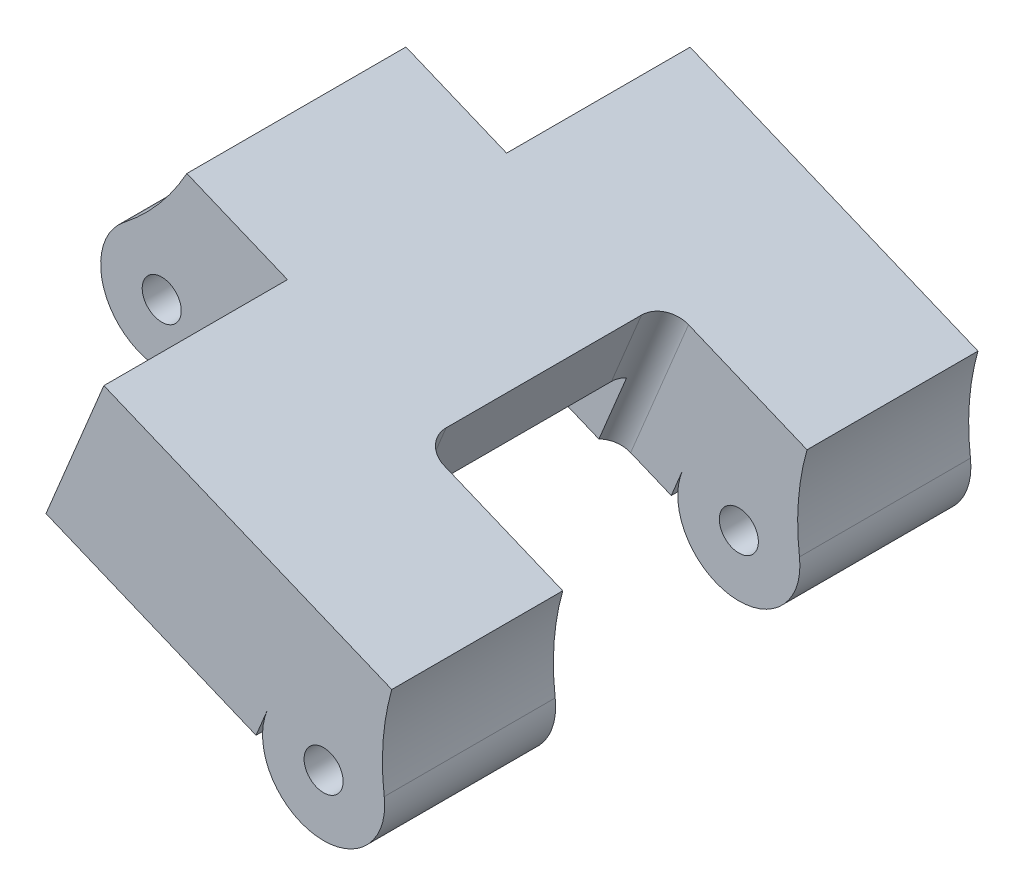
from build123d import *
from OCP.BRepAlgoAPI import BRepAlgoAPI_Cut
from OCP.TopTools import TopTools_ListOfShape

# Parameters (mm, degrees)
SALIENTE_EXTRUIR1_DEPTH      = 8
SALIENTE_EXTRUIR1_DEPTH_BACK = 16
CROQUIS1_R                   = 0.8000000000000019
CROQUIS1_R_2                 = 0.8000000000000002
CROQUIS3_W                   = 5.999999999999999
CROQUIS3_H                   = 7.5149398575439825
CORTAR_EXTRUIR1_DEPTH        = 16
CROQUIS4_W                   = 12.500000000000004
CROQUIS4_H                   = 10.000000000000002
CORTAR_EXTRUIR2_DEPTH        = 16
REDONDEO1_R                  = 10
CORTAR_EXTRUIR3_DEPTH        = 39.561831595033986
SALIENTE_EXTRUIR2_START      = -7
SALIENTE_EXTRUIR2_DEPTH      = 7
SALIENTE_EXTRUIR3_START      = -7
SALIENTE_EXTRUIR3_DEPTH      = 7
CORTAR_EXTRUIR4_DEPTH        = 39.561831595033986
SALIENTE_EXTRUIR4_START      = 0.5
SALIENTE_EXTRUIR4_DEPTH      = 0.5
SALIENTE_EXTRUIR5_DEPTH      = 0.5
REDONDEO2_R                  = 1
SALIENTE_EXTRUIR6_DEPTH      = 7.5
SALIENTE_EXTRUIR7_DEPTH      = 7.5
CORTAR_EXTRUIR5_DEPTH        = 6.192871


with BuildPart() as part:
    # Croquis1 → Saliente-Extruir1 (new, two sides: drawn at the far end of the back side and taken through both)
    with BuildSketch(Plane.XY.offset(-SALIENTE_EXTRUIR1_DEPTH_BACK)):
        with BuildLine():
            Line((2.309746663820058, 19.04340690522453), (11.832681853129706, 15.099435825287522))
            ThreePointArc((11.832681853129735, 15.099435825287586), (14.633813116183077, 11.69161014757831), (15.904999780297969, 15.915790146996653))
            Line((15.904999780297969, 15.915790146996654), (16.93335681353175, 18.398814789031395))
            Line((16.93335681353175, 18.398814789031395), (1.029391105834504, 24.985521467228967))
            Line((1.029391105834504, 24.985521467228967), (0, 22.5))
            ThreePointArc((-2.2e-16, 22.5), (-2.078639306967261, 18.611022451034337), (2.3097466638200577, 19.04340690522453))
        make_face()
        with Locations((14.142428516949789, 14.142842730512115)):
            Circle(CROQUIS1_R, mode=Mode.SUBTRACT)
        with Locations((-8e-16, 20)):
            Circle(CROQUIS1_R_2, mode=Mode.SUBTRACT)
    extrude(amount=SALIENTE_EXTRUIR1_DEPTH + SALIENTE_EXTRUIR1_DEPTH_BACK)

    # Croquis3 → Cortar-Extruir1 (cut)
    with BuildSketch(Plane(origin=(8.98354685928157, 21.691268210929703, 0), x_dir=(0.9238986655280315, -0.38263723791016835, 0), z_dir=(0.38263723791016835, 0.9238986655280315, 0))):
        Polygon((-10.15274475820337, -8), (-4.152744758203371, -8), (-4.152744758203371, -0.4850601424560169), (-10.15274475820337, -0.48506014245601775), align=None)
        with Locations((-7.1527447582033705, 12.242530071228009)):
            Rectangle(CROQUIS3_W, CROQUIS3_H)
    extrude(amount=-CORTAR_EXTRUIR1_DEPTH, mode=Mode.SUBTRACT)

    # Croquis4 → Cortar-Extruir2 (cut)
    with BuildSketch(Plane(origin=(8.98354685928157, 21.691268210929703, 0), x_dir=(0.9238986655280315, -0.38263723791016835, 0), z_dir=(0.38263723791016835, 0.9238986655280315, 0))):
        with Locations((8.604634091236255, 4.000000000000001)):
            Rectangle(CROQUIS4_W, CROQUIS4_H)
    extrude(amount=-CORTAR_EXTRUIR2_DEPTH, mode=Mode.SUBTRACT)

    # Redondeo1
    # the kernel refuses this fillet: 10 mm, written as the material it adds along each edge
    with BuildSketch(Plane(origin=(15.90499978029797, 15.915790146996653, 1), x_dir=(0.43937810664982085, -0.898302220523148, 0), z_dir=(0, 0, 1))) as redondeo1_piece_1:
        with BuildLine():
            CenterArc((4.909244259441116, 9.449263834962537), REDONDEO1_R, 228.0261529616087, 22.86990266701423)
            Line((-1.7786689833312208, 2.0147620724265707), (-1.9124272481866686, 1.8660720371758521))
            ThreePointArc((-1.9124272481866686, 1.8660720371758521), (-1.0392674370387214, 0.8750174766821813), (-0.14993294537311094, -0.13236355953110399))
            Line((-0.14993294537311094, -0.13236355953110399), (0.06545659012588191, -0.18898527669924975))
            ThreePointArc((0.06545659012588191, -0.18898527669924975), (0.8182073765735266, -0.06231595874062915), (1.5709581630211649, -0.18898527669925216))
            Line((1.5709581630211649, -0.18898527669925216), (1.636414753147047, 6e-17))
        make_face()
    extrude(amount=7)
    with BuildSketch(Plane(origin=(15.90499978029797, 15.915790146996653, -16), x_dir=(0.43937810664982085, -0.898302220523148, 0), z_dir=(0, 0, 1))) as redondeo1_piece_2:
        with BuildLine():
            CenterArc((4.909244259441116, 9.449263834962537), REDONDEO1_R, 228.0261529616087, 22.86990266701423)
            Line((-1.7786689833312208, 2.0147620724265707), (-1.9124272481866686, 1.8660720371758521))
            ThreePointArc((-1.9124272481866686, 1.8660720371758521), (-1.0392674370387214, 0.8750174766821813), (-0.14993294537311094, -0.13236355953110399))
            Line((-0.14993294537311094, -0.13236355953110399), (0.06545659012588191, -0.18898527669924975))
            ThreePointArc((0.06545659012588191, -0.18898527669924975), (0.8182073765735266, -0.06231595874062915), (1.5709581630211649, -0.18898527669925216))
            Line((1.5709581630211649, -0.18898527669925216), (1.636414753147047, 6e-17))
        make_face()
    extrude(amount=6.999999999999998)
    with BuildSketch(Plane(origin=(-1.1e-16, 22.5, 0.4850601424560175), x_dir=(-0.9451707970750715, -0.3265764295788571, 0), z_dir=(0, 0, -1))) as redondeo1_piece_3:
        with BuildLine():
            CenterArc((4.898646443682852, 9.451707970750716), REDONDEO1_R, 228.06162230808002, 22.877267808488114)
            Line((-1.784663138412825, 2.0130674343443404), (-1.9183293300547388, 1.8642946236162135))
            ThreePointArc((-1.9183293300547388, 1.8642946236162135), (-1.0419879162330352, 0.8738575030467765), (-0.149656347026621, -0.13267621412539496))
            Line((-0.149656347026621, -0.13267621412539496), (0.06531528591577111, -0.18903415941501364))
            ThreePointArc((0.06531528591577111, -0.18903415941501364), (0.8164410739471419, -0.06292699268767933), (1.5675668619785121, -0.1890341594150131))
            Line((1.5675668619785121, -0.1890341594150131), (1.6328821478942839, -5e-17))
        make_face()
    extrude(amount=8.970120284912035)

    # Croquis5 → Cortar-Extruir3 (cut, through all)
    with BuildSketch(Plane.XY.offset(8)):
        with BuildLine():
            Line((2.309746663820078, 19.04340690522458), (2.8048354948987004, 20.238826130100847))
            ThreePointArc((2.8048354948987004, 20.238826130100847), (7.811221113299703, 18.852662916127482), (12.314929423667346, 16.26384911999791))
            Line((12.314929423667346, 16.26384911999791), (11.83268185312971, 15.099435825287534))
            Line((11.83268185312971, 15.099435825287534), (2.309746663820078, 19.04340690522458))
        make_face()
    extrude(amount=-CORTAR_EXTRUIR3_DEPTH, mode=Mode.SUBTRACT)

    # Croquis7 → Saliente-Extruir2 (add)
    with BuildSketch(Plane(origin=(0, 0, -16), x_dir=(-1, 0, 0), z_dir=(0, 0, -1)).offset(SALIENTE_EXTRUIR2_START)):
        with BuildLine():
            Line((-12.314929423667346, 16.26384911999791), (-11.83268185312971, 15.099435825287534))
            Line((-11.83268185312971, 15.099435825287534), (-2.309746663820078, 19.04340690522458))
            Line((-2.309746663820078, 19.04340690522458), (-2.8048354948986987, 20.238826130100847))
            ThreePointArc((-2.8048354948986987, 20.238826130100847), (-7.811221113299688, 18.852662916127446), (-12.314929423667346, 16.26384911999791))
        make_face()
    extrude(amount=SALIENTE_EXTRUIR2_DEPTH)

    # Croquis8 → Saliente-Extruir3 (add)
    with BuildSketch(Plane.XY.offset(8).offset(SALIENTE_EXTRUIR3_START)):
        with BuildLine():
            Line((11.83268185312971, 15.099435825287534), (12.314929423667346, 16.26384911999791))
            ThreePointArc((12.314929423667346, 16.26384911999791), (11.149114957675053, 17.083977118308297), (9.929630744917306, 17.821941587347368))
            ThreePointArc((9.929630744917306, 17.821941587347368), (6.961487524857346, 19.186020427437004), (3.815730334224168, 20.066245940784494))
            ThreePointArc((3.815730334224168, 20.066245940784494), (3.311351692275589, 20.158796440416758), (2.8048354948986964, 20.238826130100843))
            Line((2.8048354948986964, 20.238826130100843), (2.309746663820078, 19.04340690522458))
            Line((2.309746663820078, 19.04340690522458), (11.83268185312971, 15.099435825287534))
        make_face()
    extrude(amount=SALIENTE_EXTRUIR3_DEPTH)

    # Croquis9 → Cortar-Extruir4 (cut, through all)
    with BuildSketch(Plane(origin=(0, 0, -16), x_dir=(-1, 0, 0), z_dir=(0, 0, -1))):
        Polygon((-3.815730334224168, 20.066245940784487), (-3.233645329348107, 18.66076966731441), (-2.309746663820078, 19.04340690522458), (-2.8048354948986987, 20.238826130100847), (-2.8048354948987475, 20.252229554385092), (-3.8209148592802196, 20.078764261810548), align=None)
    extrude(amount=-CORTAR_EXTRUIR4_DEPTH, mode=Mode.SUBTRACT)

    # Croquis10 → Saliente-Extruir4 (add)
    with BuildSketch(Plane.XY.offset(-9.000000000000002).offset(SALIENTE_EXTRUIR4_START)):
        with BuildLine():
            Line((3.233645329348107, 18.66076966731441), (3.8157303342241673, 20.06624594078449))
            ThreePointArc((3.8157303342241673, 20.06624594078449), (6.961487524857336, 19.186020427436976), (9.929630744917306, 17.821941587347368))
            Line((9.929630744917306, 17.821941587347368), (9.24580396443071, 16.170804198329783))
            Line((9.24580396443071, 16.170804198329783), (3.233645329348107, 18.66076966731441))
        make_face()
    extrude(amount=-SALIENTE_EXTRUIR4_DEPTH)

    # Croquis11 → Saliente-Extruir5 (add)
    with BuildSketch(Plane(origin=(0, 0, 1), x_dir=(-1, 0, 0), z_dir=(0, 0, -1))):
        with BuildLine():
            Line((-9.929630744917324, 17.8219415873474), (-9.245803964430717, 16.170804198329783))
            Line((-9.245803964430717, 16.170804198329783), (-3.233645329348109, 18.66076966731441))
            Line((-3.233645329348109, 18.66076966731441), (-3.815730334224181, 20.066245940784526))
            ThreePointArc((-3.815730334224181, 20.066245940784526), (-6.9614875248573655, 19.18602042743705), (-9.929630744917324, 17.8219415873474))
        make_face()
    extrude(amount=SALIENTE_EXTRUIR5_DEPTH)

    # Redondeo2
    redondeo2_edges = [part.edges().sort_by_distance(p)[0] for p in [
        (10.202397059206133, 18.48055086214986, -9.000000000000002),
        (10.202397059206136, 18.48055086214986, 1),
    ]]
    fillet(redondeo2_edges, radius=REDONDEO2_R)

    # Croquis12 → Saliente-Extruir6 (add)
    with BuildSketch(Plane.XY.offset(8)):
        Polygon((11.83268185312971, 15.099435825287534), (11.436504054366878, 14.142842730512099), (11.37624481953794, 13.997343492256391), (2.7772082957563384, 17.558677334283267), (3.233645329348107, 18.66076966731441), align=None)
    extrude(amount=-SALIENTE_EXTRUIR6_DEPTH)

    # Croquis13 → Saliente-Extruir7 (add)
    with BuildSketch(Plane(origin=(0, 0, -16), x_dir=(-1, 0, 0), z_dir=(0, 0, -1))):
        Polygon((-3.233645329348117, 18.660769667314405), (-2.7772082957563384, 17.558677334283267), (-11.37624481953794, 13.997343492256391), (-11.83268185312971, 15.099435825287534), align=None)
    extrude(amount=-SALIENTE_EXTRUIR7_DEPTH)


with BuildPart() as cortar_extruir5_tool:
    # Croquis15 → Cortar-Extruir5 (new body)
    with BuildSketch(Plane(origin=(8.98354685928157, 21.691268210929703, 0), x_dir=(0.9238986655280315, -0.38263723791016835, 0), z_dir=(0.38263723791016835, 0.9238986655280315, 0))):
        with BuildLine():
            Line((8.604634091236257, 9.000000000000002), (8.604634091236257, -1))
            Line((8.604634091236257, -1), (3.3546340912362544, -1))
            ThreePointArc((3.3546340912362544, -1), (2.6475273100497065, -0.7071067811865478), (2.354634091236254, 1.2e-16))
            Line((2.354634091236254, 1.2e-16), (2.354634091236254, 8))
            ThreePointArc((2.354634091236254, 8), (2.6475273100497057, 8.70710678118655), (3.3546340912362544, 9.000000000000002))
            Line((3.3546340912362544, 9.000000000000002), (8.604634091236257, 9.000000000000002))
        make_face()
    extrude(amount=-CORTAR_EXTRUIR5_DEPTH)


with BuildPart() as part_1:
    add(part.part)

    # Cortar-Extruir5: cut by cortar_extruir5_tool, with a tolerance
    cortar_extruir5_stock = TopTools_ListOfShape()
    cortar_extruir5_stock.Append(part_1.part.wrapped)
    cortar_extruir5_tools = TopTools_ListOfShape()
    cortar_extruir5_tools.Append(cortar_extruir5_tool.part.wrapped)
    cortar_extruir5_cut = BRepAlgoAPI_Cut()
    cortar_extruir5_cut.SetArguments(cortar_extruir5_stock)
    cortar_extruir5_cut.SetTools(cortar_extruir5_tools)
    cortar_extruir5_cut.SetFuzzyValue(0.00001)
    cortar_extruir5_cut.Build()
    add(Compound.cast(cortar_extruir5_cut.Shape()).solids(), mode=Mode.REPLACE)


solid = part_1.part
